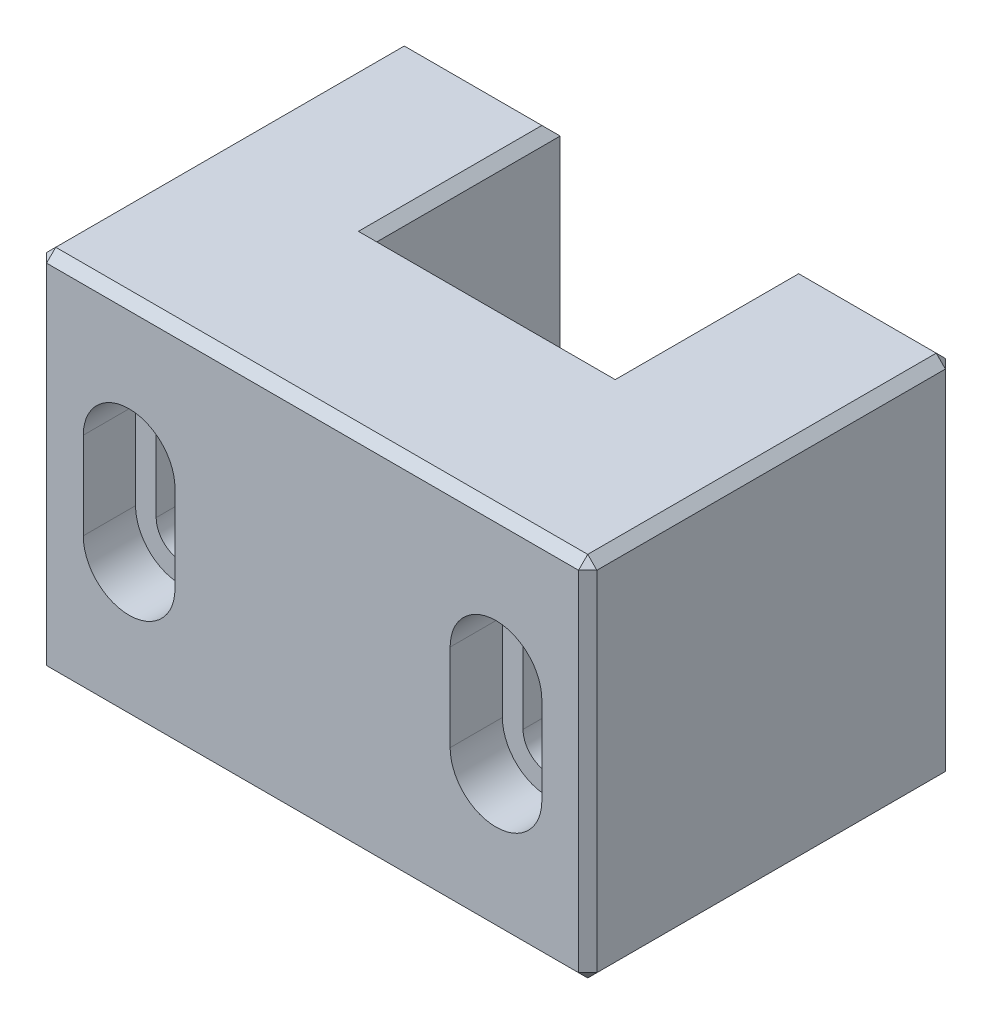
from build123d import *

# Parameters (mm, degrees)
SKETCH_1_W            = 60
SKETCH_1_H            = 40
EXTRUDE_1_DEPTH       = 40
HOLE_WIZARD_5_DEPTH   = 40
HOLE_START            = 34.3
HOLE_WIZARD_5_2_DEPTH = 5.7
SKETCH_9_W            = 26
SKETCH_9_H            = 20
CUT_EXTRUDE_1_DEPTH   = 65.031242374
CHAMFER_1_SIZE        = 1


# Read off the part's stored shape, not the designer's step: 打孔尺寸(%根据)内六角圆柱头螺钉的类型5
with BuildPart() as part:
    # 草图1 → 凸台-拉伸1 (new body)
    with BuildSketch(Plane.XY):
        Rectangle(SKETCH_1_W, SKETCH_1_H)
    extrude(amount=EXTRUDE_1_DEPTH)

    # 打孔尺寸(%根据)内六角圆柱头螺钉的类型5 outline → 打孔尺寸(%根据)内六角圆柱头螺钉的类型5 (cut)
    with BuildSketch(Plane.XY):
        with BuildLine():
            Line((17.25, 4.75), (17.25, -4.75))
            ThreePointArc((17.25, -4.75), (20, -7.5), (22.75, -4.75))
            Line((22.75, -4.75), (22.75, 4.75))
            ThreePointArc((22.75, 4.75), (20, 7.5), (17.25, 4.75))
        make_face()
        with BuildLine():
            Line((-22.75, 4.75), (-22.75, -4.75))
            ThreePointArc((-22.75, -4.75), (-20, -7.5), (-17.25, -4.75))
            Line((-17.25, -4.75), (-17.25, 4.75))
            ThreePointArc((-17.25, 4.75), (-20, 7.5), (-22.75, 4.75))
        make_face()
    extrude(amount=HOLE_WIZARD_5_DEPTH, mode=Mode.SUBTRACT)

    # Hole Wizard 5 2 outline → Hole Wizard 5 2 (cut)
    # profile 1 of 2: a face of its own
    with BuildSketch(Plane.XY.offset(HOLE_START)):
        with BuildLine():
            Line((15, 4.75), (15, -4.75))
            ThreePointArc((15, -4.75), (20, -9.75), (25, -4.75))
            Line((25, -4.75), (25, 4.75))
            ThreePointArc((25, 4.75), (20, 9.75), (15, 4.75))
        make_face()
        with BuildLine():
            ThreePointArc((22.75, -4.75), (20, -7.5), (17.25, -4.75))
            Line((17.25, -4.75), (17.25, 4.75))
            ThreePointArc((17.25, 4.75), (20, 7.5), (22.75, 4.75))
            Line((22.75, 4.75), (22.75, -4.75))
        make_face(mode=Mode.SUBTRACT)
    # profile 2 of 2: a face of its own
    with BuildSketch(Plane.XY.offset(HOLE_START)):
        with BuildLine():
            Line((-25, 4.75), (-25, -4.75))
            ThreePointArc((-25, -4.75), (-20, -9.75), (-15, -4.75))
            Line((-15, -4.75), (-15, 4.75))
            ThreePointArc((-15, 4.75), (-20, 9.75), (-25, 4.75))
        make_face()
        with BuildLine():
            ThreePointArc((-17.25, -4.75), (-20, -7.5), (-22.75, -4.75))
            Line((-22.75, -4.75), (-22.75, 4.75))
            ThreePointArc((-22.75, 4.75), (-20, 7.5), (-17.25, 4.75))
            Line((-17.25, 4.75), (-17.25, -4.75))
        make_face(mode=Mode.SUBTRACT)
    extrude(amount=HOLE_WIZARD_5_2_DEPTH, mode=Mode.SUBTRACT)

    # 草图9 → 切除-拉伸1 (cut, through all)
    with BuildSketch(Plane.XZ.offset(20)):
        with Locations((0, 10)):
            Rectangle(SKETCH_9_W, SKETCH_9_H)
    extrude(amount=-CUT_EXTRUDE_1_DEPTH, mode=Mode.SUBTRACT)

    # 倒角1
    chamfer_1_edges = [part.edges().sort_by_distance(p)[0] for p in [
        (-30, 0, 40),
        (0, -20, 40),
        (30, 0, 40),
        (-21.5, -20, 0),
        (-30, 0, 0),
        (21.5, 20, 0),
        (21.5, -20, 0),
        (-21.5, 20, 0),
        (30, 0, 0),
        (13, 20, 10),
        (-13, 20, 10),
        (0, 20, 20),
        (13, -20, 10),
        (0, -20, 20),
        (-13, -20, 10),
        (0, 20, 40),
        (30, -20, 20),
        (-30, -20, 20),
        (-30, 20, 20),
        (30, 20, 20),
    ]]
    chamfer(chamfer_1_edges, length=CHAMFER_1_SIZE)


solid = part.part
